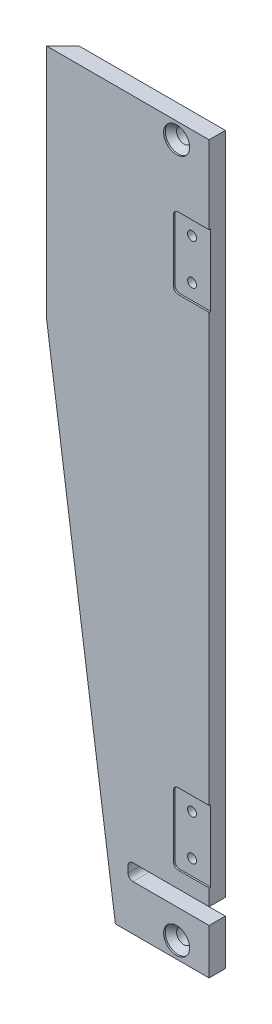
from build123d import *

# Parameters (mm, degrees)
BOSS_EXTRUDE1_DEPTH                          = 10
CHAMFER1_SIZE                                = 10
CSK_FOR_M8_HEX_SOCKET_COUNTERSUNK_HE_2_COUNT = 2
CSK_FOR_M8_HEX_SOCKET_COUNTERSUNK_HE_2_PITCH = 427
CUT_EXTRUDE1_DEPTH                           = 30
CUT_EXTRUDE2_DEPTH                           = 1
SKETCH6_R                                    = 2.75
CUT_EXTRUDE3_DEPTH                           = 459.137533935


with BuildPart() as part:
    # Sketch1 → Boss-Extrude1 (new body)
    with BuildSketch(Plane.XY):
        Polygon((0, 0), (-100, 0), (-100, -146), (-57.697208755, -447), (0, -447), align=None)
    extrude(amount=BOSS_EXTRUDE1_DEPTH)

    # Chamfer1
    chamfer1_edges = [part.edges().sort_by_distance(p)[0] for p in [
        (-78.848604377, -296.5, 0),
        (-100, -73, 0),
    ]]
    chamfer(chamfer1_edges, length=CHAMFER1_SIZE - 0.0001)  # a hair under: the kernel refuses the full size

    # Sketch3 → CSK for M8 Hex Socket Countersunk Head Screw1 (revolve, cut)
    with BuildSketch(Plane(origin=(-20, -10, 10), x_dir=(0, -1, 0), z_dir=(1, 0, 0))):
        Polygon((0, 0), (0, 10), (4.5, 10), (4.5, 4.5), (8, 1), (8, 0), align=None)
    csk_for_m8_hex_socket_countersunk_head_s = revolve(axis=Axis((-20, -10, 16.35), (0, 0, -1)), mode=Mode.SUBTRACT)

    # CSK for M8 Hex Socket Countersunk He 2: CSK for M8 Hex Socket Countersunk Head Screw1 ×2
    with Locations(*[(0, -i * CSK_FOR_M8_HEX_SOCKET_COUNTERSUNK_HE_2_PITCH, 0) for i in range(1, CSK_FOR_M8_HEX_SOCKET_COUNTERSUNK_HE_2_COUNT)]):
        add(csk_for_m8_hex_socket_countersunk_head_s, mode=Mode.SUBTRACT)

    # Sketch4 → Cut-Extrude1 (cut)
    with BuildSketch(Plane.XY.offset(10)):
        with BuildLine():
            Line((0, -409), (-46.897208755, -409))
            ThreePointArc((-46.897208755, -409), (-49.018529098, -409.878679656), (-49.897208755, -412))
            Line((-49.897208755, -412), (-49.897208755, -416))
            ThreePointArc((-49.897208755, -416), (-49.018529098, -418.121320344), (-46.897208755, -419))
            Line((-46.897208755, -419), (0, -419))
            Line((0, -419), (0, -409))
        make_face()
    extrude(amount=-CUT_EXTRUDE1_DEPTH, mode=Mode.SUBTRACT)

    # Sketch5 → Cut-Extrude2 (cut)
    with BuildSketch(Plane.XY.offset(10)):
        with BuildLine():
            Line((-19, -48), (0, -48))
            Line((0, -48), (0, -92))
            Line((0, -92), (-19, -92))
            ThreePointArc((-19, -92), (-21.121320344, -91.121320344), (-22, -89))
            Line((-22, -89), (-22, -51))
            ThreePointArc((-22, -51), (-21.121320344, -48.878679656), (-19, -48))
        make_face()
        with BuildLine():
            Line((-19, -355), (0, -355))
            Line((0, -355), (0, -399))
            Line((0, -399), (-19, -399))
            ThreePointArc((-19, -399), (-21.121320344, -398.121320344), (-22, -396))
            Line((-22, -396), (-22, -358))
            ThreePointArc((-22, -358), (-21.121320344, -355.878679656), (-19, -355))
        make_face()
    extrude(amount=-CUT_EXTRUDE2_DEPTH, mode=Mode.SUBTRACT)

    # Sketch6 → Cut-Extrude3 (cut, through all)
    with BuildSketch(Plane.XY.offset(9)):
        with Locations((-11.5, -57.5)):
            Circle(SKETCH6_R)
        with Locations((-11.5, -82.5)):
            Circle(SKETCH6_R)
        with Locations((-11.5, -364.5)):
            Circle(SKETCH6_R)
        with Locations((-11.5, -389.5)):
            Circle(SKETCH6_R)
    extrude(amount=-CUT_EXTRUDE3_DEPTH, mode=Mode.SUBTRACT)


solid = part.part
